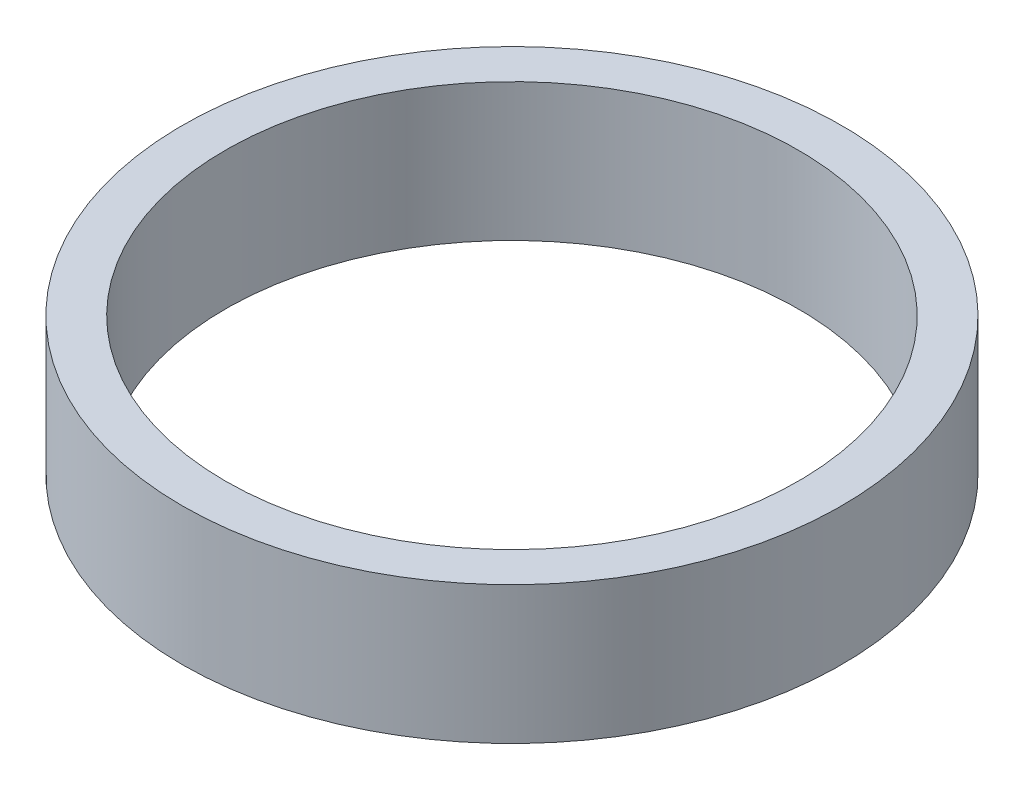
from build123d import *

# Parameters (mm, degrees)
SKETCH1_R           = 57.5
BOSS_EXTRUDE1_DEPTH = 24
SKETCH2_R           = 50
CUT_EXTRUDE1_DEPTH  = 85.785022262


with BuildPart() as part:
    # Sketch1 → Boss-Extrude1 (new body)
    with BuildSketch(Plane(origin=(0, 0, 0), x_dir=(1, 0, 0), z_dir=(0, 1, 0))):
        Circle(SKETCH1_R)
    extrude(amount=BOSS_EXTRUDE1_DEPTH)

    # Sketch2 → Cut-Extrude1 (cut, through all)
    with BuildSketch(Plane(origin=(0, 0, 0), x_dir=(1, 0, 0), z_dir=(0, 1, 0))):
        Circle(SKETCH2_R)
    extrude(amount=CUT_EXTRUDE1_DEPTH, mode=Mode.SUBTRACT)


solid = part.part
